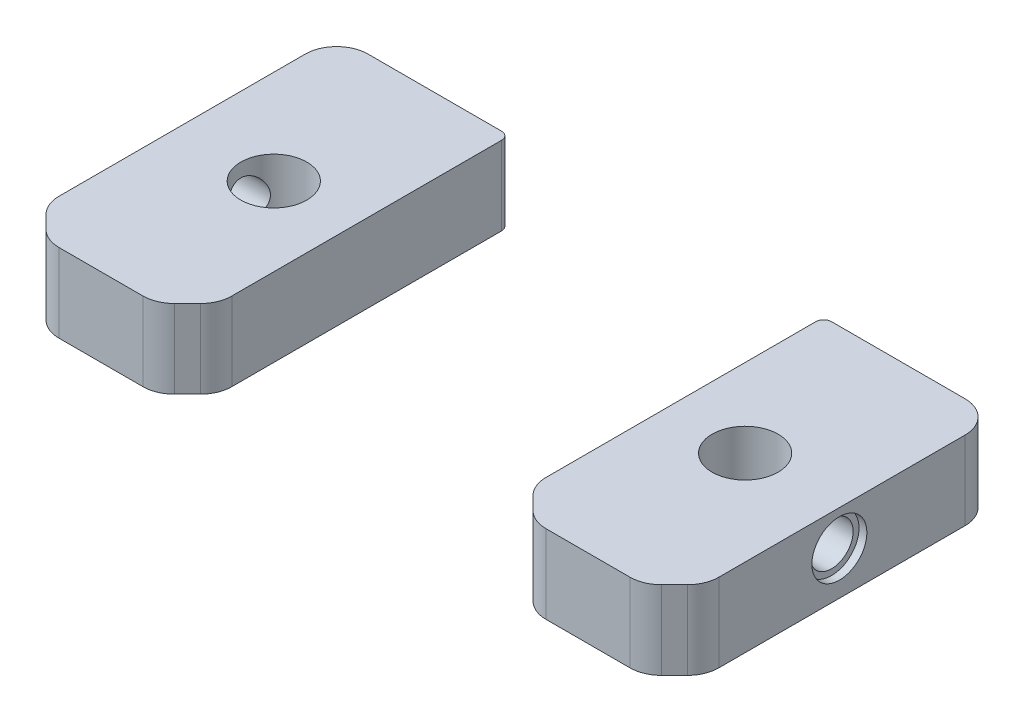
from build123d import *

# Parameters (mm, degrees)
ESQUISSE1_R                 = 4.2
BOSS_EXTRU_1_DEPTH          = 10
CHANFREIN3_SIZE             = 4
CONG_2_R                    = 4
ESQUISSE3_R                 = 4
BOSS_EXTRU_2_DEPTH          = 2
BOSS_EXTRU_2_2_DEPTH        = 2
ENL_V_START                 = -42
ENL_V_MAT_EXTRU_4_OUTLINE_R = 2.75
ENL_V_MAT_EXTRU_4_DEPTH     = 8.825492271
CONG_4_R                    = 4
ESQUISSE7_R                 = 2.75
ENL_V_MAT_EXTRU_5_DEPTH     = 8.5
ESQUISSE7_4_R               = 3.5
ESQUISSE7_4_R_2             = 2.75
ENL_V_MAT_EXTRU_8_DEPTH     = 1
ESQUISSE8_R                 = 3.5
ENL_V_MAT_EXTRU_9_DEPTH     = 1
ENL_V_START_2               = -1
ESQUISSE9_R                 = 3.5
ENL_V_MAT_EXTRU_10_DEPTH    = 1
ESQUISSE10_W                = 40
ESQUISSE10_H                = 50.736146746
ENL_V_MAT_EXTRU_11_DEPTH    = 10
CONG_5_R                    = 1
CONG_6_R                    = 1


# Read off the part's stored shape, not the designer's step: Enlèv. mat.-Extru.4
with BuildPart() as part:
    # Esquisse1 → Boss.-Extru.1 (new body)
    # profile 1 of 4: a face of its own
    with BuildSketch(Plane(origin=(0, 0, 0), x_dir=(1, 0, 0), z_dir=(0, 1, 0))):
        Polygon((-20, 6.5), (-20, 12), (-20, 13.5), (-15, 13.5), (0, 13.5), (0, 20), (-42, 20), (-42, 12), (-42, 0), (-42, -21), (-20, -21), align=None)
        with Locations(Location((-30, 0, 0), (0, 0, 270))):
            Circle(ESQUISSE1_R, mode=Mode.SUBTRACT)
    # profile 2 of 4: a face of its own
    with BuildSketch(Plane(origin=(0, 0, 0), x_dir=(1, 0, 0), z_dir=(0, 1, 0))):
        Polygon((0, 20), (0, 13.5), (15, 13.5), (20, 13.5), (20, 12), (20, 6.5), (20, -21), (42, -21), (42, 0), (42, 12), (42, 20), align=None)
        with Locations(Location((30, 0, 0), (0, 0, 270))):
            Circle(ESQUISSE1_R, mode=Mode.SUBTRACT)
    # profile 3 of 4: a face of its own
    with BuildSketch(Plane(origin=(0, 0, 0), x_dir=(1, 0, 0), z_dir=(0, 1, 0))):
        Polygon((-20, 13.5), (-20, 12), (-20, 6.5), (-15, 13.5), align=None)
    # profile 4 of 4: a face of its own
    with BuildSketch(Plane(origin=(0, 0, 0), x_dir=(1, 0, 0), z_dir=(0, 1, 0))):
        Polygon((20, 13.5), (15, 13.5), (20, 6.5), (20, 12), align=None)
    extrude(amount=BOSS_EXTRU_1_DEPTH)

    # Chanfrein3
    chanfrein3_edges = [part.edges().sort_by_distance(p)[0] for p in [
        (-20, 5, 21),
        (-42, 5, 21),
        (42, 5, 21),
        (20, 5, 21),
    ]]
    chamfer(chanfrein3_edges, length=CHANFREIN3_SIZE)

    # Congé2
    cong_2_edges = [part.edges().sort_by_distance(p)[0] for p in [
        (42, 5, 17),
        (24, 5, 21),
        (38, 5, 21),
        (20, 5, 17),
        (-24, 5, 21),
        (-38, 5, 21),
        (-42, 5, 17),
        (-20, 5, 17),
    ]]
    fillet(cong_2_edges, radius=CONG_2_R)

    # Enlèv. mat.-Extru.4 outline → Enlèv. mat.-Extru.4 (cut)
    with BuildSketch(Plane.YZ.offset(ENL_V_START)):
        with Locations((5.5, 0)):
            Circle(ENL_V_MAT_EXTRU_4_OUTLINE_R)
    enl_v_mat_extru_4 = extrude(amount=ENL_V_MAT_EXTRU_4_DEPTH, mode=Mode.SUBTRACT)

    # Symétrie10: Enlèv. mat.-Extru.4 across plane
    add(enl_v_mat_extru_4.mirror(Plane(origin=(0, 0, 0), x_dir=(0, 0, 1), z_dir=(1, 0, 0))), mode=Mode.SUBTRACT)

    # Congé4
    cong_4_edges = [part.edges().sort_by_distance(p)[0] for p in [
        (-42, 5, -20),
        (42, 5, -20),
        (20, 5, -6.5),
        (15, 5, -13.5),
        (-15, 5, -13.5),
        (-20, 5, -6.5),
    ]]
    fillet(cong_4_edges, radius=CONG_4_R)

    # Esquisse7 → Enlèv. mat.-Extru.5 (cut)
    with BuildSketch(Plane.XZ):
        with Locations(Location((-35, -13, 0), (0, 0, 270))):
            Circle(ESQUISSE7_R)
        with Locations(Location((35, -13, 0), (0, 0, 270))):
            Circle(ESQUISSE7_R)
    extrude(amount=-ENL_V_MAT_EXTRU_5_DEPTH, mode=Mode.SUBTRACT)

    # Esquisse7<4> → Enlèv. mat.-Extru.8 (cut)
    # profile 1 of 2: a face of its own
    with BuildSketch(Plane.XZ):
        with Locations(Location((-35, -13, 0), (0, 0, 270))):
            Circle(ESQUISSE7_4_R)
        with Locations(Location((-35, -13, 0), (0, 0, 270))):
            Circle(ESQUISSE7_4_R_2, mode=Mode.SUBTRACT)
    # profile 2 of 2: a face of its own
    with BuildSketch(Plane.XZ):
        with Locations(Location((35, -13, 0), (0, 0, 270))):
            Circle(ESQUISSE7_4_R)
        with Locations(Location((35, -13, 0), (0, 0, 270))):
            Circle(ESQUISSE7_4_R_2, mode=Mode.SUBTRACT)
    extrude(amount=-ENL_V_MAT_EXTRU_8_DEPTH, mode=Mode.SUBTRACT)

    # Esquisse8 → Enlèv. mat.-Extru.9 (cut)
    with BuildSketch(Plane.ZY.offset(42)):
        with Locations((0, 5.5)):
            Circle(ESQUISSE8_R)
    extrude(amount=-ENL_V_MAT_EXTRU_9_DEPTH, mode=Mode.SUBTRACT)

    # Esquisse9 → Enlèv. mat.-Extru.10 (cut)
    with BuildSketch(Plane(origin=(42, 0, 0), x_dir=(0, 0, -1), z_dir=(1, 0, 0)).offset(ENL_V_START_2)):
        with Locations(Location((0, 5.5, 0), (0, 0, 180))):
            Circle(ESQUISSE9_R)
    extrude(amount=ENL_V_MAT_EXTRU_10_DEPTH, mode=Mode.SUBTRACT)

    # Esquisse10 → Enlèv. mat.-Extru.11 (cut)
    with BuildSketch(Plane(origin=(0, 10, 0), x_dir=(1, 0, 0), z_dir=(0, 1, 0))):
        Rectangle(ESQUISSE10_W, ESQUISSE10_H)
    extrude(amount=-ENL_V_MAT_EXTRU_11_DEPTH, mode=Mode.SUBTRACT)


with BuildPart() as body_2:
    # Esquisse3 → Boss.-Extru.2 (new body)
    with BuildSketch(Plane.XZ):
        with Locations(Location((-30, 0, 0), (0, 0, 270))):
            Circle(ESQUISSE3_R)
    extrude(amount=-BOSS_EXTRU_2_DEPTH)


with BuildPart() as body_3:
    # Esquisse3 → Boss.-Extru.2 2 (new body)
    with BuildSketch(Plane.XZ):
        with Locations(Location((30, 0, 0), (0, 0, 90))):
            Circle(ESQUISSE3_R)
    extrude(amount=-BOSS_EXTRU_2_2_DEPTH)


with BuildPart() as enl_v_mat_extru_11_piece_1:
    # of the separate pieces the step leaves, piece 1, a body of its own (enl_v_mat_extru_11_pieces)
    add(part.part.solids().sort_by_distance((-42, 0, -16))[0])

    # Congé5
    cong_5_edges = [enl_v_mat_extru_11_piece_1.edges().sort_by_distance(p)[0] for p in [
        (-20, 5, -20),
    ]]
    fillet(cong_5_edges, radius=CONG_5_R)


with BuildPart() as enl_v_mat_extru_11_piece_2:
    # of the separate pieces the step leaves, piece 2, a body of its own (enl_v_mat_extru_11_pieces)
    add(part.part.solids().sort_by_distance((20, 0, -20))[0])

    # Congé6
    cong_6_edges = [enl_v_mat_extru_11_piece_2.edges().sort_by_distance(p)[0] for p in [
        (20, 5, -20),
    ]]
    fillet(cong_6_edges, radius=CONG_6_R)


solid = Compound([body_2.part, body_3.part, enl_v_mat_extru_11_piece_1.part, enl_v_mat_extru_11_piece_2.part])
